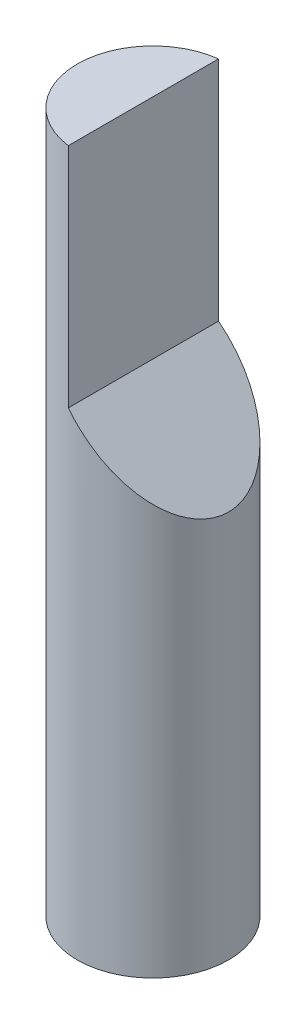
from build123d import *

# Parameters (mm, degrees)
SKETCH1_R               = 0.4
BOSS_EXTRUDE1_DEPTH     = 3.7
CUT_EXTRUDE1_DEPTH      = 4.742993454
CUT_EXTRUDE1_DEPTH_BACK = 4.742993454


with BuildPart() as part:
    # Sketch1 → Boss-Extrude1 (new body)
    with BuildSketch(Plane(origin=(0, 0, 0), x_dir=(1, 0, 0), z_dir=(0, 1, 0))):
        Circle(SKETCH1_R)
    extrude(amount=BOSS_EXTRUDE1_DEPTH)

    # Sketch3 → Cut-Extrude1 (cut, two sides: drawn at the far end of the back side and taken through both)
    with BuildSketch(Plane.XY.offset(-CUT_EXTRUDE1_DEPTH_BACK)):
        Polygon((-0.05, 3.7), (-0.05, 2.5), (0.4, 2.05), (0.4, 3.7), align=None)
    extrude(amount=CUT_EXTRUDE1_DEPTH + CUT_EXTRUDE1_DEPTH_BACK, mode=Mode.SUBTRACT)


solid = part.part
